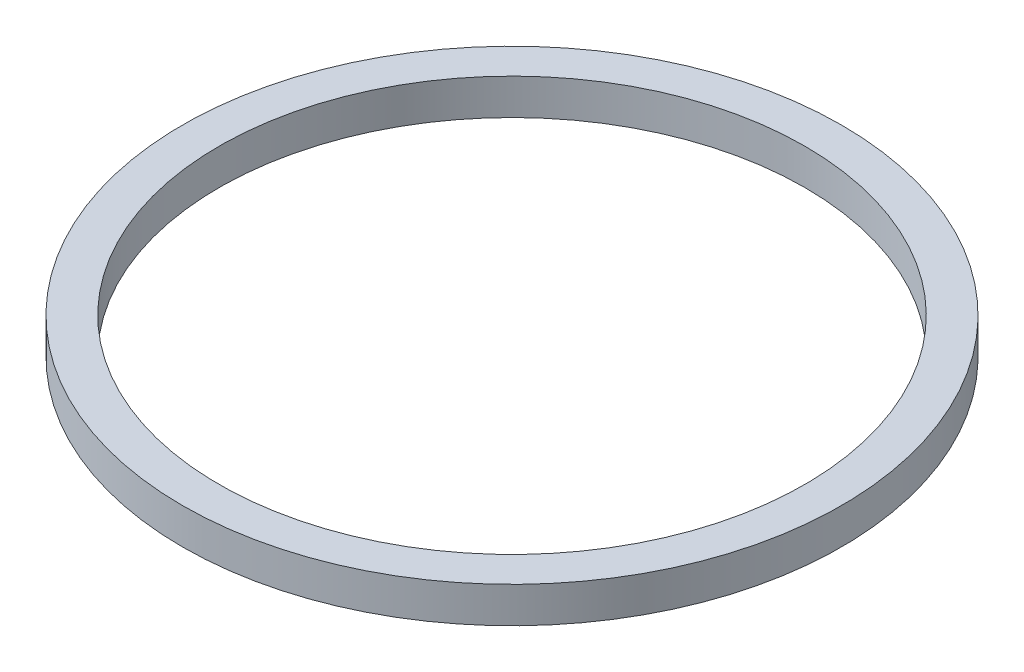
from build123d import *

# Parameters (mm, degrees)
SKETCH1_W = 7.5
SKETCH1_H = 7.3475


with BuildPart() as part:
    # Sketch1 → Revolve1 (revolve)
    with BuildSketch(Plane.XY):
        with Locations((-63.75, 4.45875)):
            Rectangle(SKETCH1_W, SKETCH1_H)
    revolve(axis=Axis((0, -200069.047495165, 0), (0, 1, 0)))


solid = part.part
